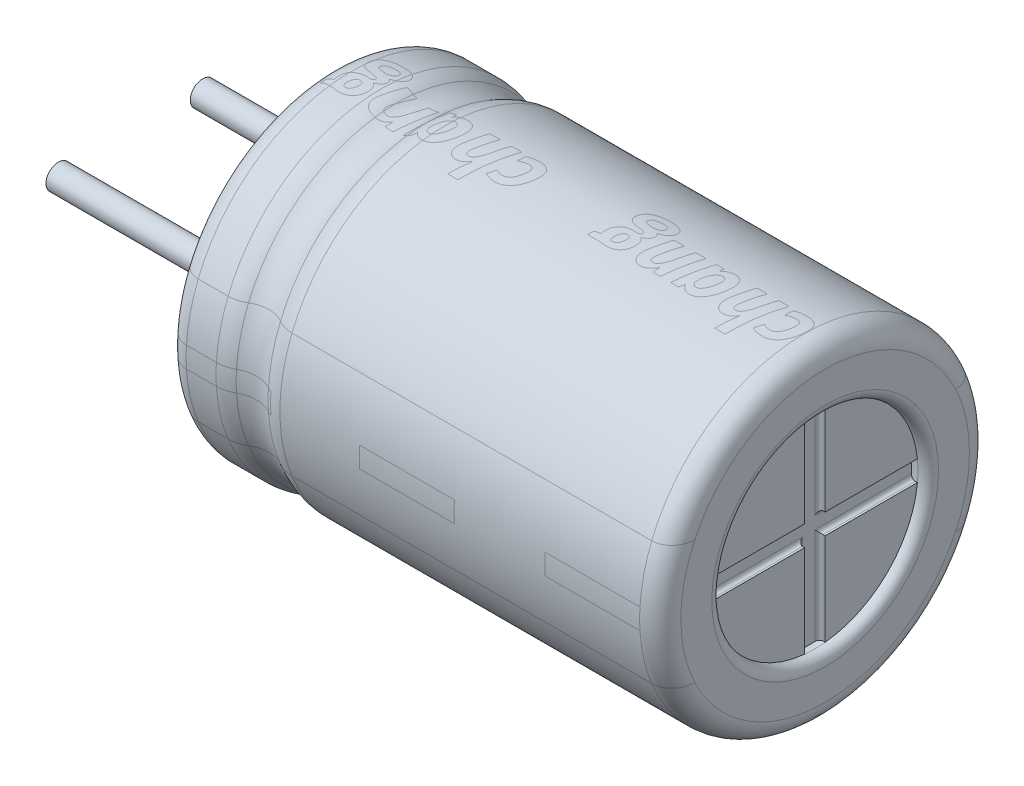
from build123d import *

# Parameters (mm, degrees)
FILLET_1_R          = 0.8
SKETCH_2_R          = 2.5
CUT_EXTRUDE_1_DEPTH = 0.25
FILLET_2_R          = 0.5
CUT_EXTRUDE_2_DEPTH = 0.15
FILLET_3_R          = 0.1
CUT_EXTRUDE_START   = -0.15
SKETCH_5_R          = 2.5
CUT_EXTRUDE_3_DEPTH = 0.15
SKETCH_6_R          = 0.3
EXTRUDE_2_DEPTH     = 5
FILLET_4_R          = 0.5
FILLET_6_R          = 0.25
FILLET_5_R          = 0.25


# Some blends are built 0.0001 mm under size
with BuildPart() as part:
    # Эскиз1 → Повернуть1 (revolve)
    with BuildSketch(Plane.XY, mode=Mode.PRIVATE) as revolve_1_sk:
        with BuildLine():
            Line((0, 0), (0, 4))
            Line((0, 4), (1.470849738, 4))
            ThreePointArc((1.470849738, 4), (2, 3.8), (2.529150262, 4))
            Line((2.529150262, 4), (12, 4))
            Line((12, 4), (12, 0))
            Line((12, 0), (0, 0))
        make_face()
    revolve(revolve_1_sk.sketch.rotate(Axis((-7.119144013, 0, 0), (1, 0, 0)), 90), axis=Axis((-7.119144013, 0, 0), (1, 0, 0)))

    # Скругление1
    fillet_1_edges = [part.edges().sort_by_distance(p)[0] for p in [
        (1.470849738, 0, -4),
        (2.529150262, 0, -4),
    ]]
    fillet(fillet_1_edges, radius=FILLET_1_R)

    # Эскиз2 → Вырез-Вытянуть1 (cut)
    with BuildSketch(Plane(origin=(12, 0, 0), x_dir=(0, 0, -1), z_dir=(1, 0, 0))):
        Circle(SKETCH_2_R)
    extrude(amount=-CUT_EXTRUDE_1_DEPTH, mode=Mode.SUBTRACT)

    # Скругление2
    fillet_2_edges = [part.edges().sort_by_distance(p)[0] for p in [
        (12, 0, -4),
    ]]
    fillet(fillet_2_edges, radius=FILLET_2_R)

    # Эскиз4 → Вырез-Вытянуть2 (cut)
    with BuildSketch(Plane(origin=(11.75, 0, 0), x_dir=(0, 0, -1), z_dir=(1, 0, 0))):
        with BuildLine():
            Line((-0.25, 2.487468593), (-0.25, 0.25))
            Line((-0.25, 0.25), (-2.487468593, 0.25))
            ThreePointArc((-2.487468593, 0.25), (-2.5, 0), (-2.487468593, -0.25))
            Line((-2.487468593, -0.25), (-0.25, -0.25))
            Line((-0.25, -0.25), (-0.25, -2.487468593))
            ThreePointArc((-0.25, -2.487468593), (0, -2.5), (0.25, -2.487468593))
            Line((0.25, -2.487468593), (0.25, -0.25))
            Line((0.25, -0.25), (2.487468593, -0.25))
            ThreePointArc((2.487468593, -0.25), (2.5, 0), (2.487468593, 0.25))
            Line((2.487468593, 0.25), (0.25, 0.25))
            Line((0.25, 0.25), (0.25, 2.487468593))
            ThreePointArc((0.25, 2.487468593), (0, 2.5), (-0.25, 2.487468593))
        make_face()
    extrude(amount=-CUT_EXTRUDE_2_DEPTH, mode=Mode.SUBTRACT)

    # Скругление3
    fillet_3_edges = [part.edges().sort_by_distance(p)[0] for p in [
        (11.6, 1.368734296, -0.25),
        (11.6, 0.25, -1.368734296),
        (11.6, -0.25, -1.368734296),
        (11.6, -1.368734296, -0.25),
        (11.6, -1.368734296, 0.25),
        (11.6, -0.25, 1.368734296),
        (11.6, 0.25, 1.368734296),
        (11.6, 1.368734296, 0.25),
    ]]
    fillet(fillet_3_edges, radius=FILLET_3_R)

    # Эскиз5 → Вырез-Вытянуть3 (cut)
    with BuildSketch(Plane.ZY.offset(CUT_EXTRUDE_START)):
        with Locations(Location((0, 0, 0), (0, 0, 180))):
            Circle(SKETCH_5_R)
    extrude(amount=CUT_EXTRUDE_3_DEPTH, mode=Mode.SUBTRACT)

    # Эскиз6 → Бобышка-Вытянуть2 (add)
    with BuildSketch(Plane.ZY.offset(-0.15)):
        with Locations((-1.75, 0)):
            Circle(SKETCH_6_R)
        with Locations(Location((1.75, 0, 0), (0, 0, 180))):
            Circle(SKETCH_6_R)
    extrude(amount=EXTRUDE_2_DEPTH)

    # Скругление4
    fillet_4_edges = [part.edges().sort_by_distance(p)[0] for p in [
        (0, 0, -4),
    ]]
    fillet(fillet_4_edges, radius=FILLET_4_R)

    # Скругление6
    # the kernel refuses this fillet: 0.25 mm, written as the material it takes off along each edge
    with BuildSketch(Plane(origin=(0, 0, 0), x_dir=(0, 0, -1), z_dir=(0, 1, 0))) as fillet_6_piece_1:
        with BuildLine():
            CenterArc((2.729128785, -0.25), FILLET_6_R, 90, 66.421821522)
            Line((2.5, -0.15), (2.495417424, -0.148))
            ThreePointArc((2.495417424, -0.148), (2.495, -0.075), (2.495, 0))
            Line((2.495, 0), (2.5, 0.005))
            Line((2.5, 0.005), (2.729128785, 0.005))
            Line((2.729128785, 0.005), (2.729128785, 0))
        make_face()
    revolve(axis=Axis((0, 0, 0), (-1, 0, 0)), mode=Mode.SUBTRACT)

    # Скругление5
    fillet_5_edges = [part.edges().sort_by_distance(p)[0] for p in [
        (12, 0, 2.5),
    ]]
    fillet(fillet_5_edges, radius=FILLET_5_R - 0.0001)  # a hair under: the kernel refuses the full size


solid = part.part
